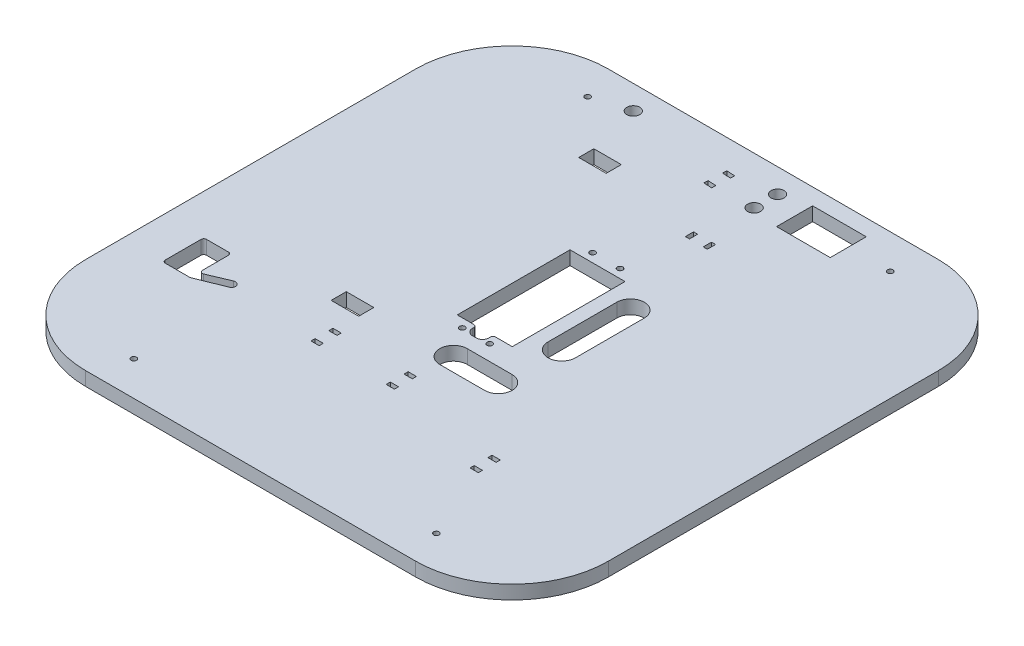
from build123d import *

# Parameters (mm, degrees)
ESBO_O1_W                   = 190
ESBO_O1_H                   = 190
RESSALTO_EXTRUS_O1_DEPTH    = 5
ESBO_O2_R                   = 1
CORTE_EXTRUS_O1_DEPTH       = 276.816968296
ESBO_O3_R                   = 1
CORTE_EXTRUS_O2_DEPTH       = 5
FILETE1_R                   = 35
ESBO_O4_W                   = 19.5
ESBO_O4_H                   = 13.1
CORTE_EXTRUS_O3_DEPTH       = 276.816968296
SKETCH1_R                   = 2.35
CUT_EXTRUDE1_DEPTH          = 10
ESBO_O8_W                   = 10
ESBO_O8_H                   = 5.5
CORTE_EXTRUS_O4_DEPTH       = 276.816968296
CORTE_EXTRUS_O5_DEPTH       = 276.816968296
CORTE_EXTRUS_O7_DEPTH       = 276.816968296
CORTE_EXTRUS_O8_START       = -5
CORTE_EXTRUS_O8_OUTLINE_W   = 1.5
CORTE_EXTRUS_O8_OUTLINE_H   = 3
CORTE_EXTRUS_O8_OUTLINE_W_2 = 3
CORTE_EXTRUS_O8_OUTLINE_H_2 = 1.5
CORTE_EXTRUS_O8_DEPTH       = 5
CORTE_EXTRUS_O9_DEPTH       = 5


# Read off the part's stored shape, not the designer's step: Corte-extrusão8, Corte-extrusão9
with BuildPart() as part:
    # Esboço1 → Ressalto-extrusão1 (new body)
    with BuildSketch(Plane(origin=(0, 0, 0), x_dir=(1, 0, 0), z_dir=(0, 1, 0))):
        with Locations((100, 100)):
            Rectangle(ESBO_O1_W, ESBO_O1_H)
    extrude(amount=RESSALTO_EXTRUS_O1_DEPTH)

    # Esboço2 → Corte-extrusão1 (cut, through all)
    with BuildSketch(Plane(origin=(0, 5, 0), x_dir=(1, 0, 0), z_dir=(0, 1, 0))):
        with Locations(Location((105, 86.9, 0), (0, 0, 270))):
            Circle(ESBO_O2_R)
        with Locations(Location((105, 134.3, 0), (0, 0, 270))):
            Circle(ESBO_O2_R)
        with Locations(Location((95, 86.9, 0), (0, 0, 90))):
            Circle(ESBO_O2_R)
        with Locations(Location((95, 134.3, 0), (0, 0, 90))):
            Circle(ESBO_O2_R)
        with BuildLine():
            Line((90, 131.1), (110, 131.1))
            Line((110, 131.1), (110, 90.1))
            Line((110, 90.1), (104, 90.1))
            ThreePointArc((104, 90.1), (103.292893219, 89.807106781), (103, 89.1))
            Line((103, 89.1), (103, 88.6))
            ThreePointArc((103, 88.6), (102.326345597, 86.973654403), (100.7, 86.3))
            Line((100.7, 86.3), (99.3, 86.3))
            ThreePointArc((99.3, 86.3), (97.673654403, 86.973654403), (97, 88.6))
            Line((97, 88.6), (97, 89.1))
            ThreePointArc((97, 89.1), (96.707106781, 89.807106781), (96, 90.1))
            Line((96, 90.1), (90, 90.1))
            Line((90, 90.1), (90, 131.1))
        make_face()
    extrude(amount=-CORTE_EXTRUS_O1_DEPTH, mode=Mode.SUBTRACT)

    # Esboço3 → Corte-extrusão2 (cut)
    with BuildSketch(Plane(origin=(0, 5, 0), x_dir=(1, 0, 0), z_dir=(0, 1, 0))):
        with Locations(Location((45, 182.5, 0), (0, 0, 270))):
            Circle(ESBO_O3_R)
        with Locations(Location((45, 17.5, 0), (0, 0, 90))):
            Circle(ESBO_O3_R)
        with Locations(Location((155, 17.5, 0), (0, 0, 270))):
            Circle(ESBO_O3_R)
        with Locations(Location((155, 182.5, 0), (0, 0, 90))):
            Circle(ESBO_O3_R)
    extrude(amount=-CORTE_EXTRUS_O2_DEPTH, mode=Mode.SUBTRACT)

    # Filete1
    filete1_edges = [part.edges().sort_by_distance(p)[0] for p in [
        (5, 2.5, -195),
        (195, 2.5, -195),
        (195, 2.5, -5),
        (5, 2.5, -5),
    ]]
    fillet(filete1_edges, radius=FILETE1_R)

    # Esboço4 → Corte-extrusão3 (cut, through all)
    with BuildSketch(Plane(origin=(0, 5, 0), x_dir=(1, 0, 0), z_dir=(0, 1, 0))):
        with Locations((130, 182.5)):
            Rectangle(ESBO_O4_W, ESBO_O4_H)
    extrude(amount=-CORTE_EXTRUS_O3_DEPTH, mode=Mode.SUBTRACT)

    # Sketch1 → Cut-Extrude1 (cut)
    with BuildSketch(Plane(origin=(0, 5, 0), x_dir=(1, 0, 0), z_dir=(0, 1, 0))):
        with Locations(Location((110.25, 177.79006803, 0), (0, 0, 90))):
            Circle(SKETCH1_R)
        with Locations(Location((57.782465694, 186.314872597, 0), (0, 0, 270))):
            Circle(SKETCH1_R)
        with Locations(Location((110.25, 186.314872597, 0), (0, 0, 270))):
            Circle(SKETCH1_R)
    extrude(amount=-CUT_EXTRUDE1_DEPTH, mode=Mode.SUBTRACT)

    # Esboço8 → Corte-extrusão4 (cut, through all)
    with BuildSketch(Plane(origin=(0, 5, 0), x_dir=(-1, 0, 0), z_dir=(0, 1, 0))):
        with Locations((-67.499895869, -164.49975707)):
            Rectangle(ESBO_O8_W, ESBO_O8_H)
        with Locations((-67.499895869, -74.50024293)):
            Rectangle(ESBO_O8_W, ESBO_O8_H)
    extrude(amount=-CORTE_EXTRUS_O4_DEPTH, mode=Mode.SUBTRACT)

    # Esboço10 → Corte-extrusão5 (cut, through all)
    with BuildSketch(Plane(origin=(0, 5, 0), x_dir=(1, 0, 0), z_dir=(0, 1, 0))):
        with BuildLine():
            Line((29.81236761, 53.368860086), (39.621292879, 57.27884335))
            ThreePointArc((39.621292879, 57.27884335), (40.643023517, 59.216773827), (38.64138653, 60.107255383))
            Line((38.64138653, 60.107255383), (31.023574835, 56.885452176))
            ThreePointArc((31.023574835, 56.885452176), (30.081566568, 56.972943613), (29.634049405, 57.806467887))
            Line((29.634049405, 57.806467887), (29.634049405, 67.297779802))
            ThreePointArc((29.634049405, 67.297779802), (29.341156187, 68.004886583), (28.634049405, 68.297779802))
            Line((28.634049405, 68.297779802), (20.634049405, 68.297779802))
            ThreePointArc((20.634049405, 68.297779802), (19.926942624, 68.004886583), (19.634049405, 67.297779802))
            Line((19.634049405, 67.297779802), (19.634049405, 54.297779802))
            ThreePointArc((19.634049405, 54.297779802), (19.926942624, 53.590673021), (20.634049405, 53.297779802))
            Line((20.634049405, 53.297779802), (29.442086417, 53.297779802))
            ThreePointArc((29.442086417, 53.297779802), (29.63060735, 53.31571063), (29.81236761, 53.368860086))
        make_face()
    extrude(amount=-CORTE_EXTRUS_O5_DEPTH, mode=Mode.SUBTRACT)

    # Esboço12 → Corte-extrusão7 (cut, through all)
    with BuildSketch(Plane(origin=(0, 5, 0), x_dir=(1, 0, 0), z_dir=(0, 1, 0))):
        with BuildLine():
            Line((115, 123.1), (115, 98.1))
            ThreePointArc((115, 98.1), (120, 93.1), (125, 98.1))
            Line((125, 98.1), (125, 123.1))
            ThreePointArc((125, 123.1), (120, 128.1), (115, 123.1))
        make_face()
    extrude(amount=-CORTE_EXTRUS_O7_DEPTH, mode=Mode.SUBTRACT)

    # Corte-extrusão8 outline → Corte-extrusão8 (cut)
    with BuildSketch(Plane(origin=(0, 5, 0), x_dir=(1, 0, 0), z_dir=(0, 1, 0)).offset(CORTE_EXTRUS_O8_START)):
        Polygon((93.630915931, 184.471333361), (93.557673586, 182.973122575), (96.554095158, 182.826637886), (96.627337502, 184.324848672), align=None)
        Polygon((96.309954009, 177.832601933), (93.313532437, 177.979086622), (93.240290093, 176.480875836), (96.236711664, 176.334391147), align=None)
        with Locations((114.04726065, 157.727587795)):
            Rectangle(CORTE_EXTRUS_O8_OUTLINE_W, CORTE_EXTRUS_O8_OUTLINE_H)
        with Locations((107.54726065, 157.727587795)):
            Rectangle(CORTE_EXTRUS_O8_OUTLINE_W, CORTE_EXTRUS_O8_OUTLINE_H)
        with Locations((100.460308888, 62.543165179)):
            Rectangle(CORTE_EXTRUS_O8_OUTLINE_W_2, CORTE_EXTRUS_O8_OUTLINE_H_2)
        with Locations((73.101842496, 62.543165179)):
            Rectangle(CORTE_EXTRUS_O8_OUTLINE_W_2, CORTE_EXTRUS_O8_OUTLINE_H_2)
        with Locations((100.460308888, 56.043165179)):
            Rectangle(CORTE_EXTRUS_O8_OUTLINE_W_2, CORTE_EXTRUS_O8_OUTLINE_H_2)
        with Locations((73.101842496, 56.043165179)):
            Rectangle(CORTE_EXTRUS_O8_OUTLINE_W_2, CORTE_EXTRUS_O8_OUTLINE_H_2)
        with Locations((142, 51.488873394)):
            Rectangle(CORTE_EXTRUS_O8_OUTLINE_W_2, CORTE_EXTRUS_O8_OUTLINE_H_2)
        with Locations((142, 44.988873394)):
            Rectangle(CORTE_EXTRUS_O8_OUTLINE_W_2, CORTE_EXTRUS_O8_OUTLINE_H_2)
    extrude(amount=CORTE_EXTRUS_O8_DEPTH, mode=Mode.SUBTRACT)

    # Corte-extrusão9 outline → Corte-extrusão9 (cut)
    with BuildSketch(Plane(origin=(0, 0, 0), x_dir=(1, 0, 0), z_dir=(0, 1, 0))):
        with BuildLine():
            Line((102.439246138, 71.3), (118.732019964, 71.3))
            ThreePointArc((118.732019964, 71.3), (123.732019964, 76.3), (118.732019964, 81.3))
            Line((118.732019964, 81.3), (102.439246138, 81.3))
            ThreePointArc((102.439246138, 81.3), (97.439246138, 76.3), (102.439246138, 71.3))
        make_face()
    extrude(amount=CORTE_EXTRUS_O9_DEPTH, mode=Mode.SUBTRACT)


solid = part.part
